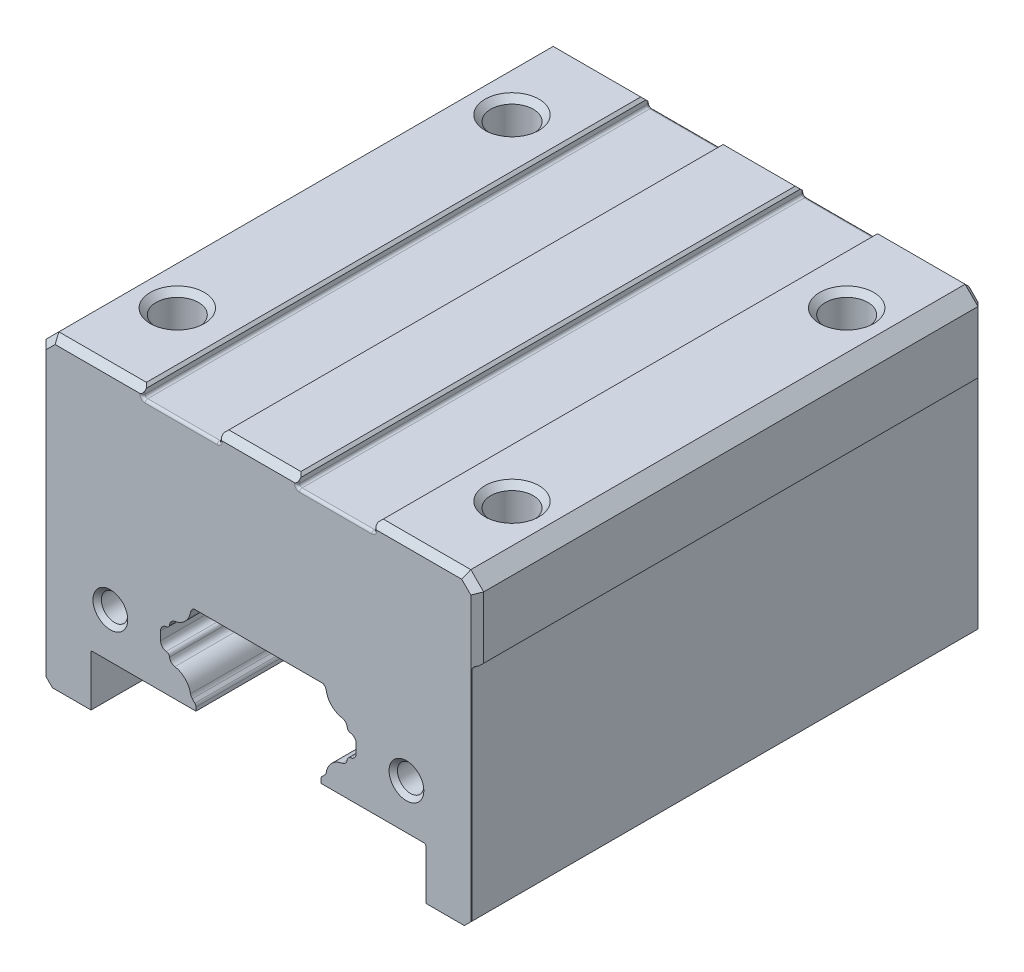
from build123d import *

# Parameters (mm, degrees)
BLOCK_BODY_DEPTH                       = 19.7
SIDE_REFERENCE_SKETCH_W                = 40
SIDE_REFERENCE_SKETCH_H                = 20
SIDE_REFERENCE_DEPTH                   = 0.45
AESTHETIC_CHAMFER_1_SIZE               = 0.5
CASTING_GROOVE_SKETCH_W                = 6
CASTING_GROOVE_SKETCH_H                = 40
CASTING_GOORVE_DEPTH                   = 0.75
AESTHETIC_CHAMFER_2_SIZE               = 0.2
PRODUCTION_FILLET_R                    = 0.2
FIXING_HOLES_D                         = 3.3
FIXING_HOLES_DEPTH                     = 7.1
FIXING_HOLES_CSINK_D                   = 4.2
FIXING_HOLES_CSINK_ANGLE               = 90
FIXING_HOLES_TIP                       = 0.991420021
END_CAP_FIXING_HOLES_FRONT_D           = 2.05
END_CAP_FIXING_HOLES_FRONT_DEPTH       = 6.35
END_CAP_FIXING_HOLES_FRONT_CSINK_D     = 2.7
END_CAP_FIXING_HOLES_FRONT_CSINK_ANGLE = 90
END_CAP_FIXING_HOLES_FRONT_TIP         = 0.615882135
END_CAP_FIXING_HOLES_BACK_D            = 2.05
END_CAP_FIXING_HOLES_BACK_DEPTH        = 6.35
END_CAP_FIXING_HOLES_BACK_CSINK_D      = 2.7
END_CAP_FIXING_HOLES_BACK_CSINK_ANGLE  = 90
END_CAP_FIXING_HOLES_BACK_TIP          = 0.615882135


with BuildPart() as part:
    # Block Profile → Block Body (new, symmetric)
    with BuildSketch(Plane.XY):
        with BuildLine():
            Line((16, 4.3), (13, 4.3))
            Line((13, 4.3), (13, 8.2))
            ThreePointArc((13, 8.2), (12.970710678, 8.270710678), (12.9, 8.3))
            Line((12.9, 8.3), (4.85, 8.3))
            Line((4.85, 8.3), (4.85, 8.584314575))
            ThreePointArc((4.85, 8.584314575), (4.87283614, 8.699119605), (4.937867966, 8.796446609))
            Line((4.937867966, 8.796446609), (5.13367604, 8.992254684))
            ThreePointArc((5.13367604, 8.992254684), (5.223715255, 9.115101334), (5.272591987, 9.259356056))
            ThreePointArc((5.272591987, 9.259356056), (5.689339828, 10.060660172), (6.490643944, 10.477408013))
            ThreePointArc((6.490643944, 10.477408013), (6.766607459, 10.625414027), (6.900414725, 10.908534598))
            ThreePointArc((6.900414725, 10.908534598), (6.98601637, 11.08386098), (7.161342753, 11.169462626))
            ThreePointArc((7.161342753, 11.169462626), (7.474614052, 11.334529402), (7.6, 11.665685425))
            Line((7.6, 11.665685425), (7.6, 12.334314575))
            ThreePointArc((7.6, 12.334314575), (7.474614052, 12.665470598), (7.161342753, 12.830537374))
            ThreePointArc((7.161342753, 12.830537374), (6.98601637, 12.91613902), (6.900414725, 13.091465402))
            ThreePointArc((6.900414725, 13.091465402), (6.766607459, 13.374585973), (6.490643944, 13.522591987))
            ThreePointArc((6.490643944, 13.522591987), (5.689339828, 13.939339828), (5.272591987, 14.740643944))
            ThreePointArc((5.272591987, 14.740643944), (5.223715255, 14.884898666), (5.13367604, 15.007745316))
            Line((5.13367604, 15.007745316), (5.041421356, 15.1))
            Line((5.041421356, 15.1), (-5.041421356, 15.1))
            Line((-5.041421356, 15.1), (-5.13367604, 15.007745316))
            ThreePointArc((-5.13367604, 15.007745316), (-5.223715255, 14.884898666), (-5.272591987, 14.740643944))
            ThreePointArc((-5.272591987, 14.740643944), (-5.689339828, 13.939339828), (-6.490643944, 13.522591987))
            ThreePointArc((-6.490643944, 13.522591987), (-6.766607459, 13.374585973), (-6.900414725, 13.091465402))
            ThreePointArc((-6.900414725, 13.091465402), (-6.98601637, 12.91613902), (-7.161342753, 12.830537374))
            ThreePointArc((-7.161342753, 12.830537374), (-7.474614052, 12.665470598), (-7.6, 12.334314575))
            Line((-7.6, 12.334314575), (-7.6, 11.665685425))
            ThreePointArc((-7.6, 11.665685425), (-7.474614052, 11.334529402), (-7.161342753, 11.169462626))
            ThreePointArc((-7.161342753, 11.169462626), (-6.98601637, 11.08386098), (-6.900414725, 10.908534598))
            ThreePointArc((-6.900414725, 10.908534598), (-6.766607459, 10.625414027), (-6.490643944, 10.477408013))
            ThreePointArc((-6.490643944, 10.477408013), (-5.689339828, 10.060660172), (-5.272591987, 9.259356056))
            ThreePointArc((-5.272591987, 9.259356056), (-5.223715255, 9.115101334), (-5.13367604, 8.992254684))
            Line((-5.13367604, 8.992254684), (-4.937867966, 8.796446609))
            ThreePointArc((-4.937867966, 8.796446609), (-4.87283614, 8.699119605), (-4.85, 8.584314575))
            Line((-4.85, 8.584314575), (-4.85, 8.3))
            Line((-4.85, 8.3), (-12.9, 8.3))
            ThreePointArc((-12.9, 8.3), (-12.970710678, 8.270710678), (-13, 8.2))
            Line((-13, 8.2), (-13, 4.3))
            Line((-13, 4.3), (-16, 4.3))
            Line((-16, 4.3), (-17, 5.3))
            Line((-17, 5.3), (-17, 27))
            Line((-17, 27), (-16, 28))
            Line((-16, 28), (16, 28))
            Line((16, 28), (17, 27))
            Line((17, 27), (17, 5.3))
            Line((17, 5.3), (16, 4.3))
        make_face()
    extrude(amount=BLOCK_BODY_DEPTH, both=True)

    # Side Reference Sketch → Side Reference (cut)
    with BuildSketch(Plane(origin=(17, 0, 0), x_dir=(0, 0, -1), z_dir=(1, 0, 0))):
        with Locations((0, 12)):
            Rectangle(SIDE_REFERENCE_SKETCH_W, SIDE_REFERENCE_SKETCH_H)
    extrude(amount=-SIDE_REFERENCE_DEPTH, mode=Mode.SUBTRACT)

    # Aesthetic Chamfer 1
    aesthetic_chamfer_1_edges = [part.edges().sort_by_distance(p)[0] for p in [
        (-17, 16.15, -19.7),
        (-16.5, 27.5, -19.7),
        (0, 28, -19.7),
        (16.5, 27.5, -19.7),
        (17, 24.5, -19.7),
        (-17, 16.15, 19.7),
        (-16.5, 27.5, 19.7),
        (17, 24.5, 19.7),
        (16.5, 27.5, 19.7),
        (0, 28, 19.7),
    ]]
    chamfer(aesthetic_chamfer_1_edges, length=AESTHETIC_CHAMFER_1_SIZE)

    # Casting Groove Sketch → Casting Goorve (cut)
    with BuildSketch(Plane(origin=(0, 28, 0), x_dir=(1, 0, 0), z_dir=(0, 1, 0))):
        with Locations((-6, 0)):
            Rectangle(CASTING_GROOVE_SKETCH_W, CASTING_GROOVE_SKETCH_H)
        with Locations((6, 0)):
            Rectangle(CASTING_GROOVE_SKETCH_W, CASTING_GROOVE_SKETCH_H)
    extrude(amount=-CASTING_GOORVE_DEPTH, mode=Mode.SUBTRACT)

    # Aesthetic Chamfer 2
    aesthetic_chamfer_2_edges = [part.edges().sort_by_distance(p)[0] for p in [
        (-9, 28, 0),
        (-3, 28, 0),
        (3, 28, 0),
        (9, 28, 0),
        (17, 22, 0),
    ]]
    chamfer(aesthetic_chamfer_2_edges, length=AESTHETIC_CHAMFER_2_SIZE)

    # Production Fillet
    production_fillet_edges = [part.edges().sort_by_distance(p)[0] for p in [
        (3, 27.375, -19.7),
        (3, 27.375, 19.7),
        (9, 27.375, -19.7),
        (9, 27.375, 19.7),
        (-9, 27.375, -19.7),
        (-9, 27.375, 19.7),
        (-3, 27.375, -19.7),
        (-3, 27.375, 19.7),
        (3, 27.25, 0),
        (6, 27.25, -19.7),
        (9, 27.25, 0),
        (6, 27.25, 19.7),
        (-9, 27.25, 0),
        (-6, 27.25, -19.7),
        (-3, 27.25, 0),
        (-6, 27.25, 19.7),
        (16.55, 22, 0),
    ]]
    fillet(production_fillet_edges, radius=PRODUCTION_FILLET_R)

    # Fixing Holes
    with Locations(Plane(origin=(0, 28, 0), x_dir=(1, 0, 0), z_dir=(0, 1, 0))):
        with Locations((-13, -13), (-13, 13), (13, 13), (13, -13)):
            CounterSinkHole(FIXING_HOLES_D / 2, FIXING_HOLES_CSINK_D / 2, depth=FIXING_HOLES_DEPTH, counter_sink_angle=FIXING_HOLES_CSINK_ANGLE)
            with Locations((0, 0, -(FIXING_HOLES_DEPTH + FIXING_HOLES_TIP / 2))):  # 118° drill point
                Cone(0, FIXING_HOLES_D / 2, FIXING_HOLES_TIP, mode=Mode.SUBTRACT)

    # End Cap Fixing Holes Front
    with Locations(Plane.XY.offset(19.7)):
        with Locations((-11.5, 11.8), (11.5, 11.8)):
            CounterSinkHole(END_CAP_FIXING_HOLES_FRONT_D / 2, END_CAP_FIXING_HOLES_FRONT_CSINK_D / 2, depth=END_CAP_FIXING_HOLES_FRONT_DEPTH, counter_sink_angle=END_CAP_FIXING_HOLES_FRONT_CSINK_ANGLE)
            with Locations((0, 0, -(END_CAP_FIXING_HOLES_FRONT_DEPTH + END_CAP_FIXING_HOLES_FRONT_TIP / 2))):  # 118° drill point
                Cone(0, END_CAP_FIXING_HOLES_FRONT_D / 2, END_CAP_FIXING_HOLES_FRONT_TIP, mode=Mode.SUBTRACT)

    # End Cap Fixing Holes Back
    with Locations(Plane(origin=(0, 0, -19.7), x_dir=(-1, 0, 0), z_dir=(0, 0, -1))):
        with Locations((-11.5, 11.8), (11.5, 11.8)):
            CounterSinkHole(END_CAP_FIXING_HOLES_BACK_D / 2, END_CAP_FIXING_HOLES_BACK_CSINK_D / 2, depth=END_CAP_FIXING_HOLES_BACK_DEPTH, counter_sink_angle=END_CAP_FIXING_HOLES_BACK_CSINK_ANGLE)
            with Locations((0, 0, -(END_CAP_FIXING_HOLES_BACK_DEPTH + END_CAP_FIXING_HOLES_BACK_TIP / 2))):  # 118° drill point
                Cone(0, END_CAP_FIXING_HOLES_BACK_D / 2, END_CAP_FIXING_HOLES_BACK_TIP, mode=Mode.SUBTRACT)


solid = part.part
